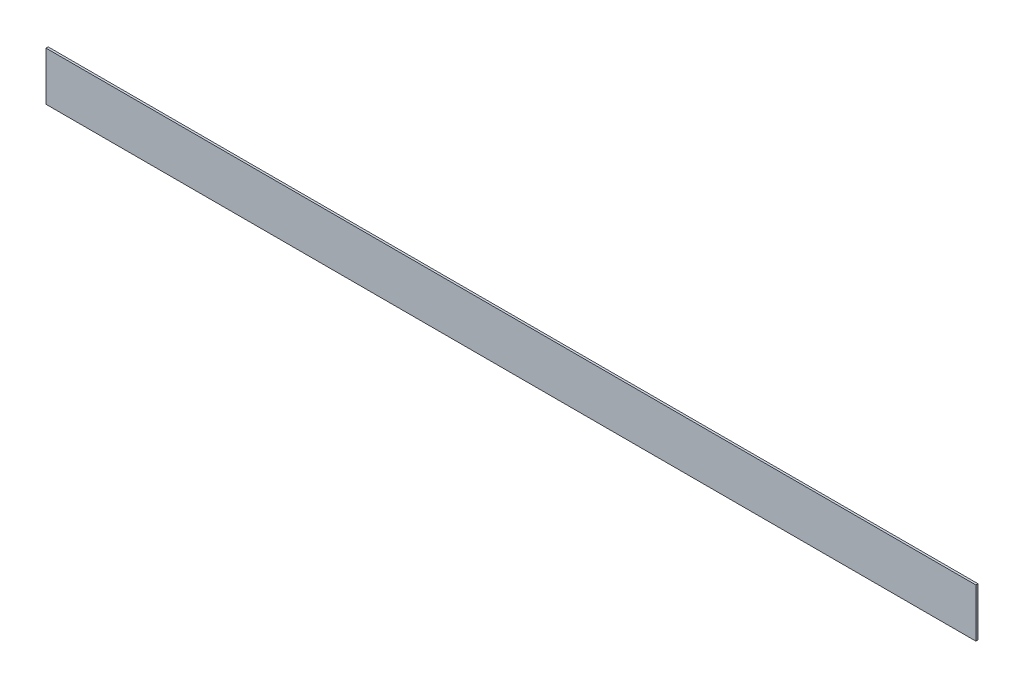
from build123d import *

# Parameters (mm, degrees)
IZIM1_W            = 1720
IZIM1_H            = 90
TABAN_FLAN_1_DEPTH = 4


# Sheet-metal steps are written as plain solids
with BuildPart() as part:
    # Çizim1 → Taban-Flanş1 (new body)
    with BuildSketch(Plane.XY):
        with Locations((860, -45)):
            Rectangle(IZIM1_W, IZIM1_H)
    extrude(amount=-TABAN_FLAN_1_DEPTH)


solid = part.part
